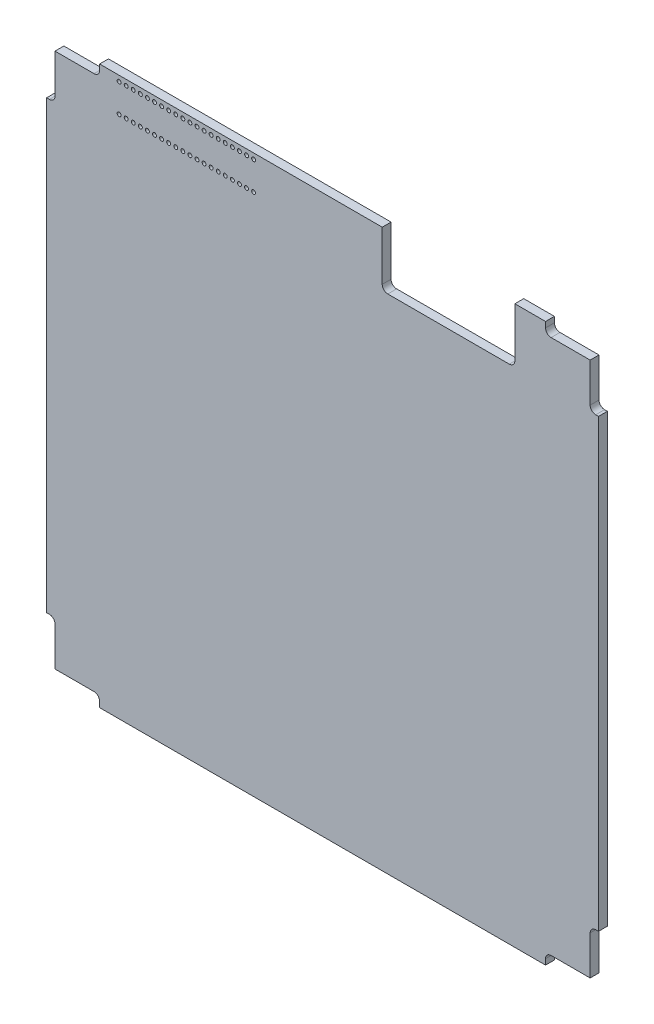
from build123d import *

# Parameters (mm, degrees)
BOSS_EXTRUDE1_DEPTH = 1.5875
FILLET1_R           = 1
SKETCH2_R           = 0.35
CUT_EXTRUDE1_DEPTH  = 71.728496069
CUT_EXTRUDE2_DEPTH  = 9.8806
FILLET2_R           = 1
SKETCH5_OUTSIDE_W   = 130.286
SKETCH5_OUTSIDE_H   = 130.286
SKETCH5_OUTSIDE_W_2 = 99
SKETCH5_OUTSIDE_H_2 = 100
CUT_EXTRUDE3_DEPTH  = 71.728496069


with BuildPart() as part:
    # Sketch1 → Boss-Extrude1 (new body)
    with BuildSketch(Plane.XY):
        Polygon((40, 50), (-40, 50), (-40, 48), (-48, 48), (-48, 40), (-50, 40), (-50, -37.864895224), (-50, -40), (-48, -40), (-48, -48), (-40, -48), (-40, -50), (-37.864895224, -50), (40, -50), (40, -48), (48, -48), (48, -40), (50, -40), (50, 40), (48, 40), (48, 48), (40, 48), align=None)
    extrude(amount=BOSS_EXTRUDE1_DEPTH)

    # Fillet1
    fillet1_edges = [part.edges().sort_by_distance(p)[0] for p in [
        (-48, -40, 0.79375),
        (-40, -48, 0.79375),
        (40, -48, 0.79375),
        (48, -40, 0.79375),
        (48, 40, 0.79375),
        (40, 48, 0.79375),
        (-40, 48, 0.79375),
        (-48, 40, 0.79375),
    ]]
    fillet(fillet1_edges, radius=FILLET1_R)

    # Sketch2 → Cut-Extrude1 (cut, through all)
    with BuildSketch(Plane.XY.offset(1.5875)):
        with Locations((-36.5, 49)):
            Circle(SKETCH2_R)
        with Locations((-35.23, 49)):
            Circle(SKETCH2_R)
        with Locations((-33.96, 49)):
            Circle(SKETCH2_R)
        with Locations((-32.69, 49)):
            Circle(SKETCH2_R)
        with Locations((-31.42, 49)):
            Circle(SKETCH2_R)
        with Locations((-30.15, 49)):
            Circle(SKETCH2_R)
        with Locations((-28.88, 49)):
            Circle(SKETCH2_R)
        with Locations((-27.61, 49)):
            Circle(SKETCH2_R)
        with Locations((-26.34, 49)):
            Circle(SKETCH2_R)
        with Locations((-25.07, 49)):
            Circle(SKETCH2_R)
        with Locations((-23.8, 49)):
            Circle(SKETCH2_R)
        with Locations((-22.53, 49)):
            Circle(SKETCH2_R)
        with Locations((-21.26, 49)):
            Circle(SKETCH2_R)
        with Locations((-19.99, 49)):
            Circle(SKETCH2_R)
        with Locations((-18.72, 49)):
            Circle(SKETCH2_R)
        with Locations((-17.45, 49)):
            Circle(SKETCH2_R)
        with Locations((-16.18, 49)):
            Circle(SKETCH2_R)
        with Locations((-14.91, 49)):
            Circle(SKETCH2_R)
        with Locations((-13.64, 49)):
            Circle(SKETCH2_R)
        with Locations((-12.37, 49)):
            Circle(SKETCH2_R)
        with Locations((-35.23, 43.92)):
            Circle(SKETCH2_R)
        with Locations((-33.96, 43.92)):
            Circle(SKETCH2_R)
        with Locations((-32.69, 43.92)):
            Circle(SKETCH2_R)
        with Locations((-31.42, 43.92)):
            Circle(SKETCH2_R)
        with Locations((-30.15, 43.92)):
            Circle(SKETCH2_R)
        with Locations((-28.88, 43.92)):
            Circle(SKETCH2_R)
        with Locations((-27.61, 43.92)):
            Circle(SKETCH2_R)
        with Locations((-26.34, 43.92)):
            Circle(SKETCH2_R)
        with Locations((-25.07, 43.92)):
            Circle(SKETCH2_R)
        with Locations((-23.8, 43.92)):
            Circle(SKETCH2_R)
        with Locations((-22.53, 43.92)):
            Circle(SKETCH2_R)
        with Locations((-21.26, 43.92)):
            Circle(SKETCH2_R)
        with Locations((-19.99, 43.92)):
            Circle(SKETCH2_R)
        with Locations((-18.72, 43.92)):
            Circle(SKETCH2_R)
        with Locations((-17.45, 43.92)):
            Circle(SKETCH2_R)
        with Locations((-16.18, 43.92)):
            Circle(SKETCH2_R)
        with Locations((-14.91, 43.92)):
            Circle(SKETCH2_R)
        with Locations((-13.64, 43.92)):
            Circle(SKETCH2_R)
        with Locations((-12.37, 43.92)):
            Circle(SKETCH2_R)
        with Locations((-36.5, 43.92)):
            Circle(SKETCH2_R)
    extrude(amount=-CUT_EXTRUDE1_DEPTH, mode=Mode.SUBTRACT)

    # Sketch3 → Cut-Extrude2 (cut)
    with BuildSketch(Plane(origin=(0, 50, 0), x_dir=(1, 0, 0), z_dir=(0, 1, 0))):
        Polygon((10.7, 0), (19.7, 0), (34.5, 0), (34.5, -1.5875), (19.7, -1.5875), (10.7, -1.5875), align=None)
    extrude(amount=-CUT_EXTRUDE2_DEPTH, mode=Mode.SUBTRACT)

    # Fillet2
    fillet2_edges = [part.edges().sort_by_distance(p)[0] for p in [
        (10.7, 40.1194, 0.79375),
        (34.5, 40.1194, 0.79375),
    ]]
    fillet(fillet2_edges, radius=FILLET2_R)

    # Sketch5 outside → Cut-Extrude3 (cut, through all)
    with BuildSketch(Plane(origin=(0, 0, 0), x_dir=(-1, 0, 0), z_dir=(0, 0, -1))):
        Rectangle(SKETCH5_OUTSIDE_W, SKETCH5_OUTSIDE_H)
        Rectangle(SKETCH5_OUTSIDE_W_2, SKETCH5_OUTSIDE_H_2, mode=Mode.SUBTRACT)
    extrude(amount=-CUT_EXTRUDE3_DEPTH, mode=Mode.SUBTRACT)


solid = part.part
